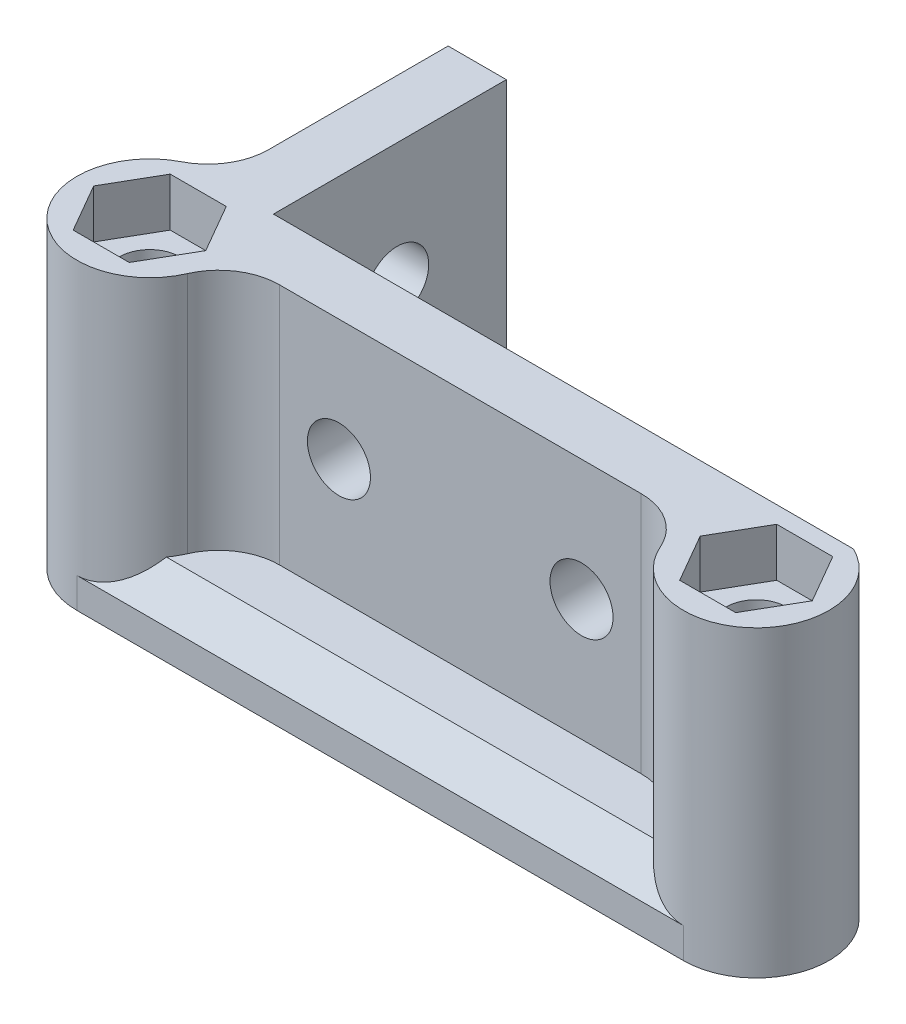
from build123d import *
from build123d.topology import SkipClean

# Parameters (mm, degrees)
BOSS_EXTRUDE1_DEPTH = 4.8
BOSS_EXTRUDE2_DEPTH = 20.2
BOSS_EXTRUDE3_DEPTH = 0.2
CHAMFER1_SIZE       = 2.5
SKETCH4_R           = 2.5
CUT_EXTRUDE1_DEPTH  = 67.076924868
CUT_EXTRUDE2_DEPTH  = 4
SKETCH6_R           = 2.6
CUT_EXTRUDE3_DEPTH  = 65.262275092
SKETCH7_R           = 2.6
CUT_EXTRUDE4_DEPTH  = 63.061260058


with BuildPart() as part:
    # Sketch1 → Boss-Extrude1 (new body)
    with BuildSketch(Plane(origin=(0, 0, 0), x_dir=(1, 0, 0), z_dir=(0, 1, 0))):
        with BuildLine():
            Line((0, -6), (50, -6))
            ThreePointArc((50, -6), (55.848076607, 1.341640786), (47.384660634, 5.4))
            Line((47.384660634, 5.4), (25.7, 5.4))
            Line((25.7, 5.4), (6.5, 24.6))
            Line((6.5, 24.6), (0, 24.6))
            Line((0, 24.6), (0, 9.797958971))
            ThreePointArc((0, 9.797958971), (-0.735985673, 7.186794132), (-2.727272727, 5.344341257))
            ThreePointArc((-2.727272727, 5.344341257), (-5.833782973, -1.402489297), (0, -6))
        make_face()
    extrude(amount=BOSS_EXTRUDE1_DEPTH)

    # Sketch2 → Boss-Extrude2 (add)
    with SkipClean():  # the faces are left unmerged after this step: merging them gives an invalid solid
        with BuildSketch(Plane(origin=(0, 4.8, 0), x_dir=(1, 0, 0), z_dir=(0, 1, 0))):
            with BuildLine():
                Line((0, 24.6), (4.8, 24.6))
                Line((4.8, 24.6), (4.8, 5.4))
                Line((4.8, 5.4), (52.615339366, 5.4))
                ThreePointArc((52.615339366, 5.4), (54.158005006, -4.325620692), (44.500909166, -2.4))
                ThreePointArc((44.500909166, -2.4), (42.656946259, -0.216699867), (39.918333471, 0.6))
                Line((39.918333471, 0.6), (10.081666529, 0.6))
                ThreePointArc((10.081666529, 0.6), (7.343053741, -0.216699867), (5.499090834, -2.4))
                ThreePointArc((5.499090834, -2.4), (-4.112717992, -4.368701262), (-2.727272727, 5.344341257))
                ThreePointArc((-2.727272727, 5.344341257), (-0.735985673, 7.186794132), (0, 9.797958971))
                Line((0, 9.797958971), (0, 24.6))
            make_face()
        extrude(amount=BOSS_EXTRUDE2_DEPTH)

    # Sketch3 → Boss-Extrude3 (add)
    with SkipClean():  # the faces are left unmerged after this step: merging them gives an invalid solid
        with BuildSketch(Plane(origin=(0, 4.8, 0), x_dir=(1, 0, 0), z_dir=(0, 1, 0))):
            with BuildLine():
                Line((39.918333471, 0.6), (10.081666529, 0.6))
                ThreePointArc((10.081666529, 0.6), (7.343053741, -0.216699867), (5.499090834, -2.4))
                ThreePointArc((5.499090834, -2.4), (3.286335345, -5.019960159), (0, -6))
                Line((0, -6), (50, -6))
                ThreePointArc((50, -6), (46.713664655, -5.019960159), (44.500909166, -2.4))
                ThreePointArc((44.500909166, -2.4), (42.656946259, -0.216699867), (39.918333471, 0.6))
            make_face()
        extrude(amount=BOSS_EXTRUDE3_DEPTH)

    # Chamfer1
    # the kernel refuses this chamfer: 2.5 mm, written as the material it takes off along each edge
    with BuildSketch(Plane(origin=(-6.42920747, 5, 6), x_dir=(0, -0.9996219169112968, 0.027495876610586317), z_dir=(1, 0, 0))) as chamfer1_piece_1_section:
        Polygon((CHAMFER1_SIZE * 0.999621916911, CHAMFER1_SIZE * 0.0274958766106), (-CHAMFER1_SIZE * 0.0274958766106, CHAMFER1_SIZE * 0.999621916911), (0, 0), align=None)
    chamfer1_piece_1 = extrude(amount=62.85841494, mode=Mode.PRIVATE)
    chamfer1_piece_1 = chamfer1_piece_1 - Plane(origin=(0, 4.144274293, 0), x_dir=(0.9165151389911681, 0, 0.3999999999999999), z_dir=(0, -1, 0)) * Cylinder(6, 136, mode=Mode.PRIVATE)
    chamfer1_piece_1 = chamfer1_piece_1 - Plane(origin=(50, 4.144274293, 0), x_dir=(0.43588989435406716, 0, -0.9000000000000001), z_dir=(0, -1, 0)) * Cylinder(6, 136, mode=Mode.PRIVATE)
    add(chamfer1_piece_1, mode=Mode.SUBTRACT)

    # Sketch4 → Cut-Extrude1 (cut, through all)
    with BuildSketch(Plane.XZ):
        with Locations(Location((0, 0, 0), (0, 0, 270))):
            Circle(SKETCH4_R)
        with Locations(Location((50, 0, 0), (0, 0, 270))):
            Circle(SKETCH4_R)
    extrude(amount=-CUT_EXTRUDE1_DEPTH, mode=Mode.SUBTRACT)

    # Sketch5 → Cut-Extrude2 (cut)
    with BuildSketch(Plane(origin=(0, 25, 0), x_dir=(1, 0, 0), z_dir=(0, 1, 0))):
        Polygon((4.618802154, 0), (2.309401077, 4), (-2.309401077, 4), (-4.618802154, 0), (-2.309401077, -4), (2.309401077, -4), align=None)
        Polygon((47.690598923, 4), (45.381197846, 0), (47.690598923, -4), (52.309401077, -4), (54.618802154, 0), (52.309401077, 4), align=None)
    extrude(amount=-CUT_EXTRUDE2_DEPTH, mode=Mode.SUBTRACT)

    # Sketch6 → Cut-Extrude3 (cut, through all)
    with BuildSketch(Plane(origin=(0, 0, -5.4), x_dir=(-1, 0, 0), z_dir=(0, 0, -1))):
        with Locations((-35, 15)):
            Circle(SKETCH6_R)
        with Locations((-15, 15)):
            Circle(SKETCH6_R)
    extrude(amount=-CUT_EXTRUDE3_DEPTH, mode=Mode.SUBTRACT)

    # Sketch7 → Cut-Extrude4 (cut, through all)
    with BuildSketch(Plane(origin=(4.8, 0, 0), x_dir=(0, 0, -1), z_dir=(1, 0, 0))):
        with Locations((15.6, 15)):
            Circle(SKETCH7_R)
    extrude(amount=-CUT_EXTRUDE4_DEPTH, mode=Mode.SUBTRACT)


solid = part.part
